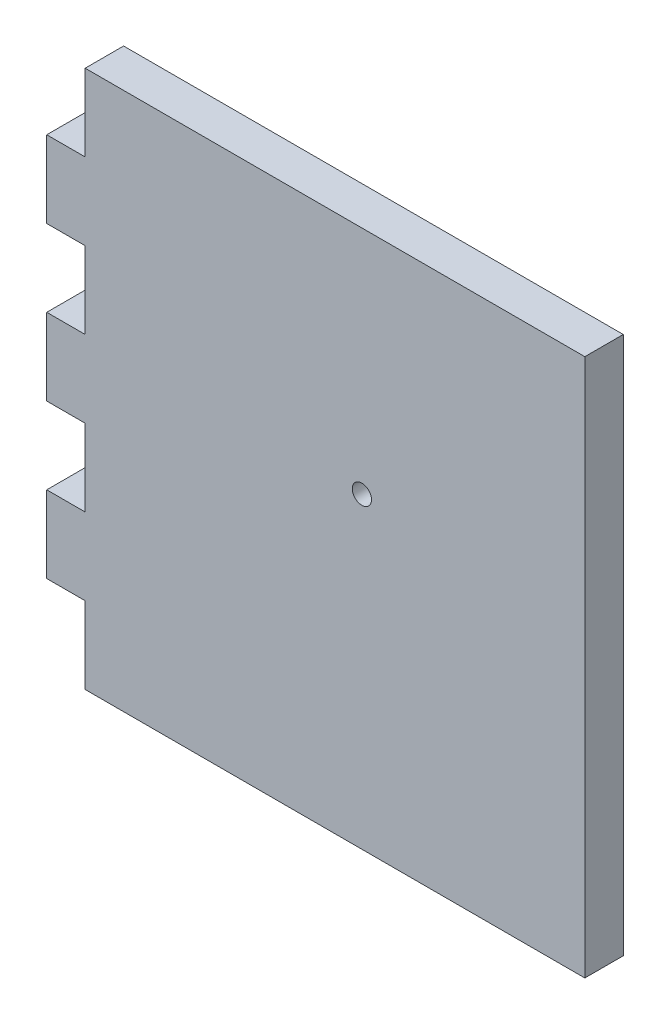
from build123d import *

# Parameters (mm, degrees)
SKETCH1_W           = 177.8
SKETCH1_H           = 177.8
BOSS_EXTRUDE1_DEPTH = 12.7
SKETCH2_R           = 3.175
CUT_EXTRUDE3_DEPTH  = 252.76769054
SKETCH4_W           = 12.7
SKETCH4_H           = 25.4
CUT_EXTRUDE4_DEPTH  = 252.76769054


with BuildPart() as part:
    # Sketch1 → Boss-Extrude1 (new body)
    with BuildSketch(Plane.XY):
        with Locations((88.9, -88.9)):
            Rectangle(SKETCH1_W, SKETCH1_H)
    extrude(amount=BOSS_EXTRUDE1_DEPTH)

    # Sketch2 → Cut-Extrude3 (cut, through all)
    with BuildSketch(Plane.XY.offset(12.7)):
        with Locations((104.14, -76.2)):
            Circle(SKETCH2_R)
    extrude(amount=-CUT_EXTRUDE3_DEPTH, mode=Mode.SUBTRACT)

    # Sketch4 → Cut-Extrude4 (cut, through all)
    with BuildSketch(Plane.XY.offset(12.7)):
        with Locations((6.35, -12.7)):
            Rectangle(SKETCH4_W, SKETCH4_H)
        with Locations((6.35, -63.5)):
            Rectangle(SKETCH4_W, SKETCH4_H)
        with Locations((6.35, -114.3)):
            Rectangle(SKETCH4_W, SKETCH4_H)
        with Locations((6.35, -165.1)):
            Rectangle(SKETCH4_W, SKETCH4_H)
    extrude(amount=-CUT_EXTRUDE4_DEPTH, mode=Mode.SUBTRACT)


solid = part.part
